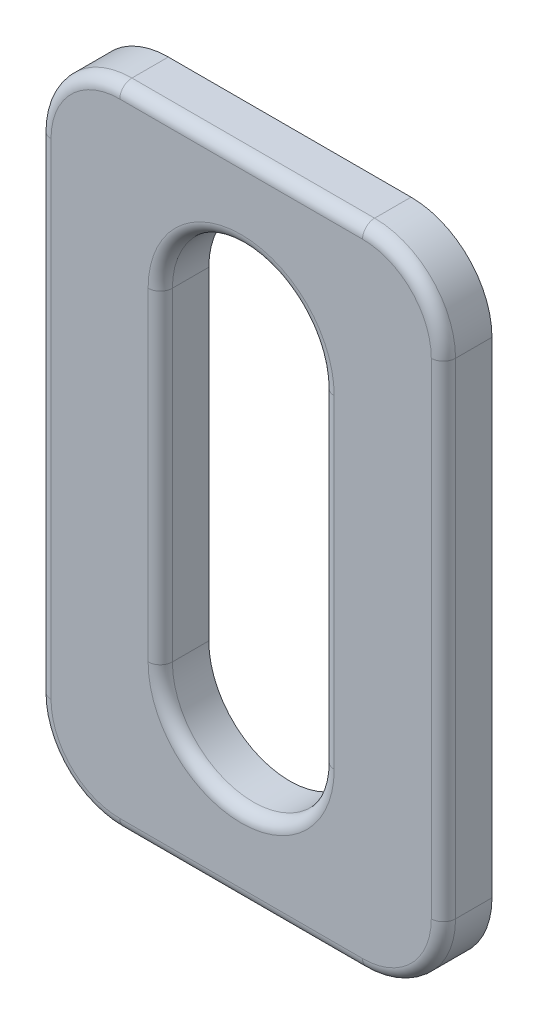
from build123d import *

# Parameters (mm, degrees)
SKETCH1_W           = 25
SKETCH1_H           = 40
BOSS_EXTRUDE1_DEPTH = 3
FILLET1_R           = 5
FILLET2_R           = 0.75


with BuildPart() as part:
    # Sketch1 → Boss-Extrude1 (new body)
    with BuildSketch(Plane.XY):
        with Locations((12.5, 20)):
            Rectangle(SKETCH1_W, SKETCH1_H)
        with BuildLine():
            Line((17.5, 30), (17.5, 10))
            ThreePointArc((17.5, 10), (12.5, 5), (7.5, 10))
            Line((7.5, 10), (7.5, 30))
            ThreePointArc((7.5, 30), (12.5, 35), (17.5, 30))
        make_face(mode=Mode.SUBTRACT)
    extrude(amount=BOSS_EXTRUDE1_DEPTH)

    # Fillet1
    fillet1_edges = [part.edges().sort_by_distance(p)[0] for p in [
        (25, 40, 1.5),
        (25, 0, 1.5),
        (0, 0, 1.5),
        (0, 40, 1.5),
    ]]
    fillet(fillet1_edges, radius=FILLET1_R)

    # Fillet2
    fillet2_edges = [part.edges().sort_by_distance(p)[0] for p in [
        (1.464466094, 1.464466094, 3),
        (0, 20, 3),
        (1.464466094, 38.535533906, 3),
        (23.535533906, 38.535533906, 3),
        (12.5, 40, 3),
        (25, 20, 3),
        (23.535533906, 1.464466094, 3),
        (12.5, 0, 3),
        (12.5, 5, 3),
        (17.5, 20, 3),
        (12.5, 35, 3),
        (7.5, 20, 3),
    ]]
    fillet(fillet2_edges, radius=FILLET2_R)


solid = part.part
